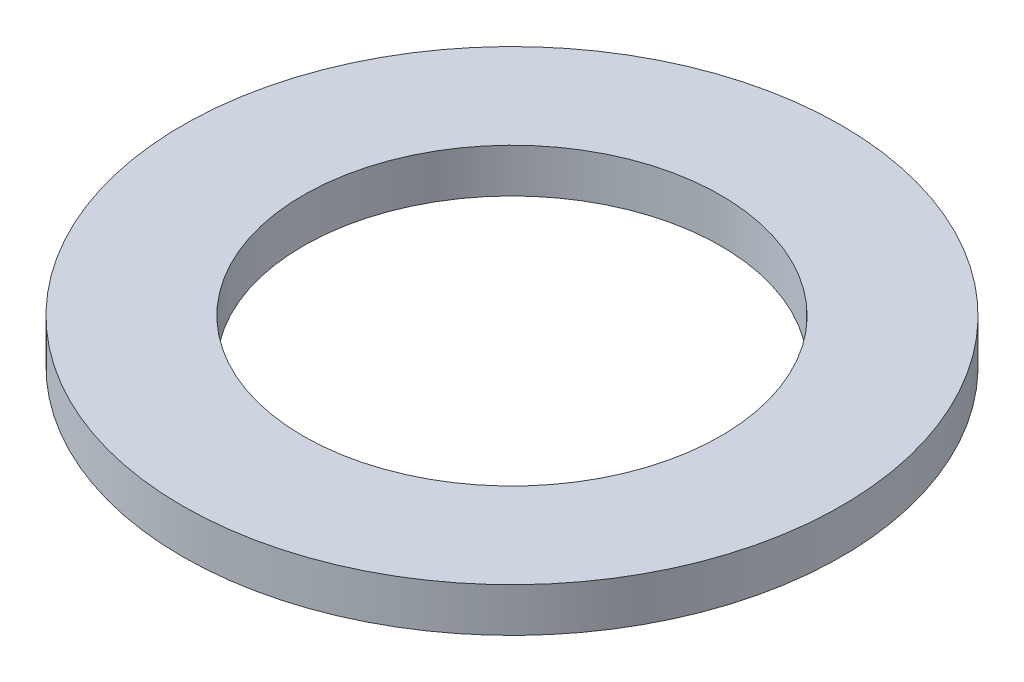
from build123d import *

# Parameters (mm, degrees)
SKETCH1_R           = 75
BOSS_EXTRUDE1_DEPTH = 10
SKETCH2_R           = 47.5
CUT_EXTRUDE1_DEPTH  = 107.536378763


with BuildPart() as part:
    # Sketch1 → Boss-Extrude1 (new body)
    with BuildSketch(Plane(origin=(0, 0, 0), x_dir=(1, 0, 0), z_dir=(0, 1, 0))):
        Circle(SKETCH1_R)
    extrude(amount=BOSS_EXTRUDE1_DEPTH)

    # Sketch2 → Cut-Extrude1 (cut, through all)
    with BuildSketch(Plane(origin=(0, 0, 0), x_dir=(1, 0, 0), z_dir=(0, 1, 0))):
        Circle(SKETCH2_R)
    extrude(amount=CUT_EXTRUDE1_DEPTH, mode=Mode.SUBTRACT)


solid = part.part
